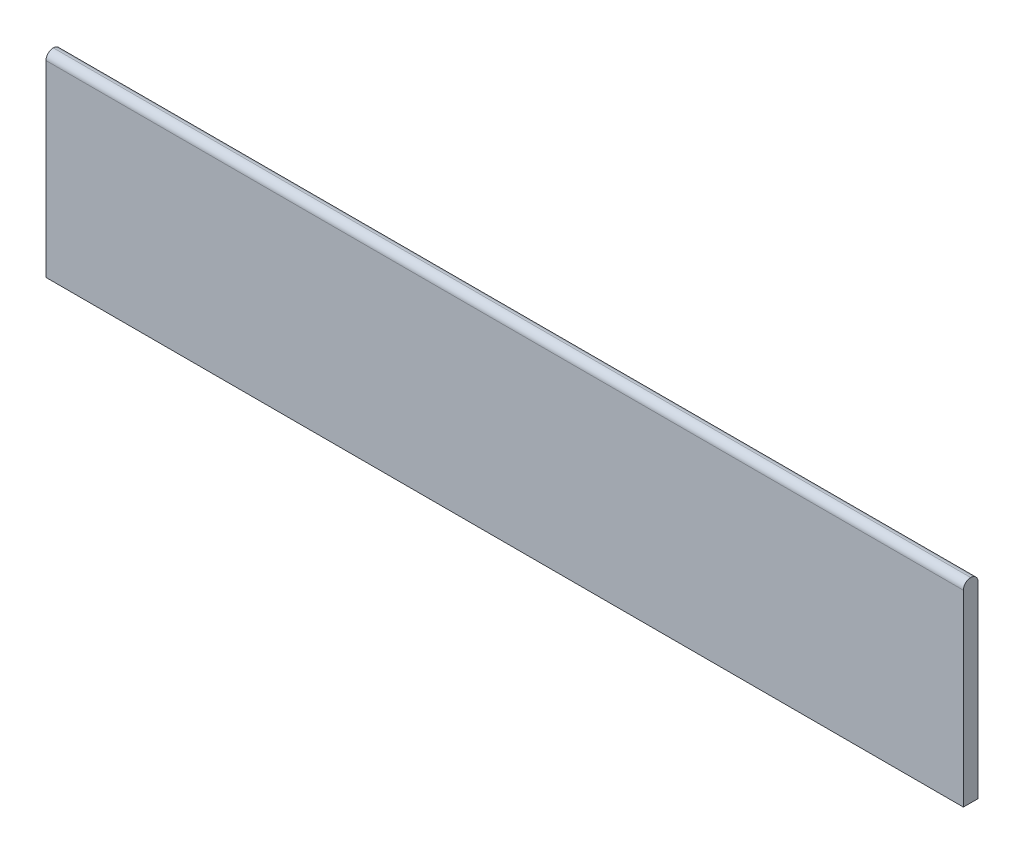
from build123d import *

# Parameters (mm, degrees)
ESQUISSE1_W        = 188
ESQUISSE1_H        = 40
BOSS_EXTRU_1_DEPTH = 3
CONG_1_R           = 1.5
CONG_3_R           = 1.5


with BuildPart() as part:
    # Esquisse1 → Boss.-Extru.1 (new body)
    with BuildSketch(Plane.XY):
        with Locations((94, 20)):
            Rectangle(ESQUISSE1_W, ESQUISSE1_H)
    extrude(amount=BOSS_EXTRU_1_DEPTH)

    # Congé1
    cong_1_edges = [part.edges().sort_by_distance(p)[0] for p in [
        (94, 40, 3),
    ]]
    fillet(cong_1_edges, radius=CONG_1_R)

    # Congé3
    cong_3_edges = [part.edges().sort_by_distance(p)[0] for p in [
        (94, 40, 0),
    ]]
    fillet(cong_3_edges, radius=CONG_3_R - 0.0001)  # a hair under: the kernel refuses the full size


solid = part.part
